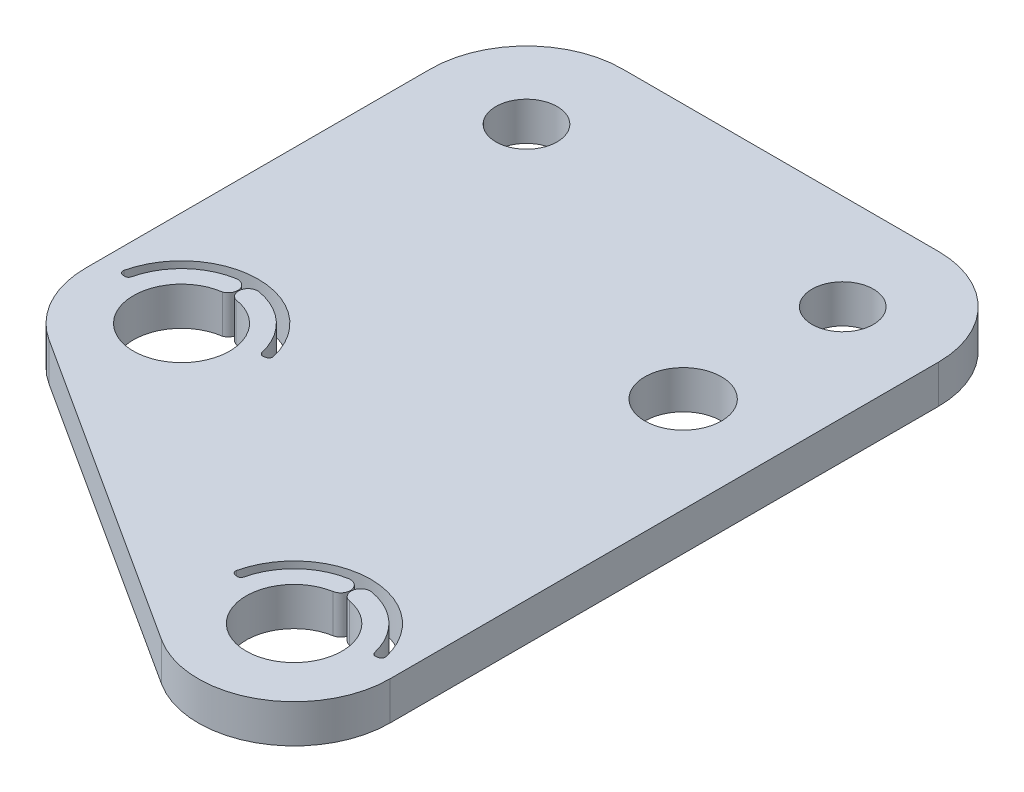
from build123d import *

# Parameters (mm, degrees)
SKETCH1_R           = 2.51
SKETCH1_R_2         = 2.5
SKETCH1_R_3         = 1.6
SKETCH1_R_4         = 2
BOSS_EXTRUDE1_DEPTH = 2
FILLET1_R           = 5
CUT_EXTRUDE2_DEPTH  = 47.884332404
SKETCH3_W           = 0.508814103
SKETCH3_H           = 0.135683761
CUT_EXTRUDE3_DEPTH  = 0.4


with BuildPart() as part:
    # Sketch1 → Boss-Extrude1 (new body)
    with BuildSketch(Plane(origin=(0, 0, 0), x_dir=(1, 0, 0), z_dir=(0, 1, 0))):
        Polygon((0, 0), (26.5, 0), (26.5, -42.791666667), (0, -25.727272727), align=None)
        with Locations((5, -23)):
            Circle(SKETCH1_R, mode=Mode.SUBTRACT)
        with Locations((21.5, -33.625)):
            Circle(SKETCH1_R_2, mode=Mode.SUBTRACT)
        with Locations((21.5, -5)):
            Circle(SKETCH1_R_3, mode=Mode.SUBTRACT)
        with Locations((5, -5)):
            Circle(SKETCH1_R_3, mode=Mode.SUBTRACT)
        with Locations((21.5, -13.325)):
            Circle(SKETCH1_R_4, mode=Mode.SUBTRACT)
    extrude(amount=BOSS_EXTRUDE1_DEPTH)

    # Fillet1
    fillet1_edges = [part.edges().sort_by_distance(p)[0] for p in [
        (26.5, 1, 0),
        (0, 1, 0),
        (0, 1, 25.727272727),
        (26.5, 1, 42.791666667),
    ]]
    fillet(fillet1_edges, radius=FILLET1_R)

    # Sketch2 → Cut-Extrude2 (cut, through all)
    with BuildSketch(Plane(origin=(0, 2, 0), x_dir=(1, 0, 0), z_dir=(0, 1, 0))):
        with BuildLine():
            Line((17.861538493, -32.983441068), (17.762917332, -32.966051496))
            ThreePointArc((17.762917332, -32.966051496), (17.630853466, -32.879452656), (17.602786281, -32.724042048))
            ThreePointArc((17.602786281, -32.724042048), (21.5, -29.625), (25.397213719, -32.724042048))
            ThreePointArc((25.397213719, -32.724042048), (25.369146534, -32.879452656), (25.237082668, -32.966051496))
            Line((25.237082668, -32.966051496), (25.138461507, -32.983441068))
            ThreePointArc((25.138461507, -32.983441068), (24.993487988, -32.953351583), (24.908935554, -32.831804949))
            ThreePointArc((24.908935554, -32.831804949), (23.907056069, -31.084118051), (22.107768622, -30.178172864))
            ThreePointArc((22.107768622, -30.178172864), (21.528540656, -30.583752652), (21.934120444, -31.162980617))
            ThreePointArc((21.934120444, -31.162980617), (21.5, -31.125), (21.065879556, -31.162980617))
            ThreePointArc((21.065879556, -31.162980617), (21.471459344, -30.583752652), (20.892231378, -30.178172864))
            ThreePointArc((20.892231378, -30.178172864), (19.092943931, -31.084118051), (18.091064446, -32.831804949))
            ThreePointArc((18.091064446, -32.831804949), (18.006512012, -32.953351583), (17.861538493, -32.983441068))
        make_face()
        with BuildLine():
            Line((1.361538493, -22.358441068), (1.262917332, -22.341051496))
            ThreePointArc((1.262917332, -22.341051496), (1.130853466, -22.254452656), (1.102786281, -22.099042048))
            ThreePointArc((1.102786281, -22.099042048), (5, -19), (8.897213719, -22.099042048))
            ThreePointArc((8.897213719, -22.099042048), (8.869146534, -22.254452656), (8.737082668, -22.341051496))
            Line((8.737082668, -22.341051496), (8.638461507, -22.358441068))
            ThreePointArc((8.638461507, -22.358441068), (8.493487988, -22.328351583), (8.408935554, -22.206804949))
            ThreePointArc((8.408935554, -22.206804949), (7.407056069, -20.459118051), (5.607768622, -19.553172864))
            ThreePointArc((5.607768622, -19.553172864), (5.028540656, -19.958752652), (5.434120444, -20.537980617))
            ThreePointArc((5.434120444, -20.537980617), (5, -20.5), (4.565879556, -20.537980617))
            ThreePointArc((4.565879556, -20.537980617), (4.971459344, -19.958752652), (4.392231378, -19.553172864))
            ThreePointArc((4.392231378, -19.553172864), (2.592943931, -20.459118051), (1.591064446, -22.206804949))
            ThreePointArc((1.591064446, -22.206804949), (1.506512012, -22.328351583), (1.361538493, -22.358441068))
        make_face()
    extrude(amount=-CUT_EXTRUDE2_DEPTH, mode=Mode.SUBTRACT)

    # Sketch3 → Cut-Extrude3 (cut)
    # profile 1 of 6: a face of its own
    with BuildSketch(Plane(origin=(0, 0, 0), x_dir=(-1, 0, 0), z_dir=(0, 0, -1))):
        Polygon((-16.413127671, 0.4), (-16.238487831, 1.722916667), (-16.22152736, 1.722916667), (-15.675347222, 0.637446581), (-15.130492121, 1.722916667), (-15.113266643, 1.722916667), (-14.937566774, 0.4), (-15.056820079, 0.4), (-15.18349359, 1.351906384), (-15.661036826, 0.4), (-15.687802567, 0.4), (-16.167200855, 1.354026442), (-16.293609358, 0.4), align=None)
    # profile 2 of 6: a face of its own
    with BuildSketch(Plane(origin=(0, 0, 0), x_dir=(-1, 0, 0), z_dir=(0, 0, -1))):
        with BuildLine():
            Line((-14.666199252, 1.722916667), (-14.401456914, 1.722916667))
            add(Edge.make_bspline(
                [(-14.401456914, 1.722916667), (-14.383789881, 1.722857859), (-14.349867219, 1.722744941), (-14.301269584, 1.722115323), (-14.257111723, 1.72031073), (-14.217416724, 1.718757783), (-14.182185316, 1.715926008), (-14.151309465, 1.713219454), (-14.124931377, 1.709676433), (-14.108963451, 1.70638599), (-14.101733607, 1.704896167)],
                knots=[0, 0, 0, 0, 1.410062039, 2.707475311, 3.878576406, 4.937260626, 5.877586885, 6.699081471, 7.410979367, 8, 8, 8, 8], degree=3))
            add(Edge.make_bspline(
                [(-14.101733607, 1.704896167), (-14.092054913, 1.702504801), (-14.072903997, 1.697773082), (-14.045330609, 1.687771982), (-14.01905585, 1.676198493), (-13.994188863, 1.662605063), (-13.970854203, 1.646890786), (-13.948811271, 1.629326943), (-13.927960039, 1.610009636), (-13.909143768, 1.588451824), (-13.891401924, 1.565835048), (-13.876438366, 1.541378568), (-13.863539369, 1.515804122), (-13.85326956, 1.488851616), (-13.845000207, 1.460782434), (-13.839169456, 1.431342323), (-13.835672727, 1.400665407), (-13.835316729, 1.379741436), (-13.835136218, 1.369131861)],
                knots=[0, 0, 0, 0, 1.027469482, 2.033020251, 3.019912614, 3.986113645, 4.951240523, 5.91722682, 6.890402269, 7.87763091, 8.8651537, 9.85103654, 10.82876324, 11.815024772, 12.821070561, 13.842952187, 14.906261191, 16, 16, 16, 16], degree=3))
            add(Edge.make_bspline(
                [(-13.835136218, 1.369131861), (-13.835691464, 1.351504902), (-13.836774894, 1.317110139), (-13.846876346, 1.26719427), (-13.863422829, 1.220631642), (-13.886223596, 1.177480883), (-13.915259528, 1.13858311), (-13.950156101, 1.10441767), (-13.990932782, 1.075827584), (-14.028892672, 1.056001672), (-14.062424527, 1.043304353), (-14.090029381, 1.034370372), (-14.120141601, 1.027467784), (-14.152472677, 1.021284043), (-14.187157154, 1.016615397), (-14.224111901, 1.013196), (-14.263363274, 1.011058904), (-14.290327744, 1.010740646), (-14.304199219, 1.010576923)],
                knots=[0, 0, 0, 0, 1.260483769, 2.459530307, 3.627416485, 4.787058657, 5.939039949, 7.08810263, 8.267026773, 9.491475466, 10.141966685, 10.831826277, 11.566392101, 12.351337768, 13.187381173, 14.07005841, 15.007169909, 16, 16, 16, 16], degree=3))
            Line((-14.304199219, 1.010576923), (-13.818175748, 0.4))
            Line((-13.818175748, 0.4), (-13.964989817, 0.4))
            Line((-13.964989817, 0.4), (-14.451013288, 1.010576923))
            Line((-14.451013288, 1.010576923), (-14.547475962, 1.010576923))
            Line((-14.547475962, 1.010576923), (-14.547475962, 0.4))
            Line((-14.547475962, 0.4), (-14.666199252, 0.4))
            Line((-14.666199252, 0.4), (-14.666199252, 1.722916667))
        make_face()
        with BuildLine():
            Line((-14.547475962, 1.587232906), (-14.547475962, 1.146260684))
            Line((-14.547475962, 1.146260684), (-14.305259248, 1.144405632))
            add(Edge.make_bspline(
                [(-14.305259248, 1.144405632), (-14.293950186, 1.144400629), (-14.272030002, 1.144390932), (-14.240317548, 1.145900484), (-14.210790006, 1.14761775), (-14.183560317, 1.150244437), (-14.158616317, 1.153629619), (-14.135970473, 1.15786408), (-14.11558582, 1.162797449), (-14.09181167, 1.170433183), (-14.065263933, 1.182530696), (-14.036412459, 1.200131346), (-14.011843123, 1.222269078), (-13.991085478, 1.24758345), (-13.974405604, 1.275416199), (-13.962645988, 1.305433695), (-13.955183815, 1.336878139), (-13.95430368, 1.358490102), (-13.953859509, 1.369396868)],
                knots=[0, 0, 0, 0, 1.146690395, 2.22261258, 3.21895312, 4.145990853, 4.996080663, 5.770904154, 6.481378293, 7.121626537, 8.300444488, 9.431385265, 10.535395872, 11.636531494, 12.74115979, 13.810798291, 14.895190096, 16, 16, 16, 16], degree=3))
            add(Edge.make_bspline(
                [(-13.953859509, 1.369396868), (-13.954313882, 1.380035603), (-13.955214283, 1.401117693), (-13.962565455, 1.431981683), (-13.974996858, 1.461111155), (-13.991749609, 1.488387612), (-14.012160004, 1.513147221), (-14.036092629, 1.53433171), (-14.062893105, 1.551812907), (-14.08794204, 1.562983759), (-14.110331162, 1.569832632), (-14.129770349, 1.574652268), (-14.151735104, 1.578524434), (-14.176332078, 1.581626885), (-14.203456265, 1.584293486), (-14.233244815, 1.586089546), (-14.265500086, 1.587153119), (-14.287856218, 1.587205691), (-14.299429087, 1.587232906)],
                knots=[0, 0, 0, 0, 1.101028733, 2.181837193, 3.264309656, 4.369019818, 5.486613113, 6.575447106, 7.666700264, 8.788928104, 9.402425223, 10.0903467, 10.862060571, 11.710948788, 12.657782767, 13.684531032, 14.801375019, 16, 16, 16, 16], degree=3))
            Line((-14.299429087, 1.587232906), (-14.547475962, 1.587232906))
        make_face(mode=Mode.SUBTRACT)
    # profile 3 of 6: a face of its own
    with BuildSketch(Plane(origin=(0, 0, 0), x_dir=(-1, 0, 0), z_dir=(0, 0, -1))):
        with BuildLine():
            Line((-13.546808226, 1.722916667), (-13.287366036, 1.722916667))
            add(Edge.make_bspline(
                [(-13.287366036, 1.722916667), (-13.269521437, 1.722897051), (-13.235330394, 1.722859467), (-13.186301191, 1.721719965), (-13.141771918, 1.720197971), (-13.101838589, 1.718088148), (-13.066378338, 1.715594794), (-13.035551621, 1.712097744), (-13.009116134, 1.708446382), (-12.993276493, 1.704734124), (-12.986052684, 1.703041116)],
                knots=[0, 0, 0, 0, 1.415646017, 2.712440637, 3.8905458, 4.950247383, 5.884950622, 6.709939814, 7.411656543, 8, 8, 8, 8], degree=3))
            add(Edge.make_bspline(
                [(-12.986052684, 1.703041116), (-12.976908105, 1.700538176), (-12.958834426, 1.695591276), (-12.932791472, 1.685683113), (-12.908013679, 1.673934795), (-12.884416036, 1.660545389), (-12.862288523, 1.644940428), (-12.841301001, 1.627752484), (-12.821638688, 1.608584718), (-12.80341215, 1.587652117), (-12.78667355, 1.565306085), (-12.772261438, 1.54121304), (-12.760193707, 1.51577853), (-12.749843482, 1.489020245), (-12.742394155, 1.460713486), (-12.736782381, 1.431054937), (-12.733220474, 1.400047777), (-12.732879327, 1.378858482), (-12.732705662, 1.368071832)],
                knots=[0, 0, 0, 0, 0.999701418, 1.975846123, 2.934577507, 3.890451536, 4.834027766, 5.787354733, 6.749476667, 7.726910423, 8.712836071, 9.690891519, 10.682875813, 11.679750201, 12.712814741, 13.765529915, 14.8625177, 16, 16, 16, 16], degree=3))
            add(Edge.make_bspline(
                [(-12.732705662, 1.368071832), (-12.732864951, 1.357194517), (-12.73317661, 1.335912317), (-12.73691717, 1.304777364), (-12.741955665, 1.275023687), (-12.749703063, 1.246717258), (-12.759850088, 1.220026178), (-12.771753334, 1.194542557), (-12.786110204, 1.170699943), (-12.802606911, 1.148411777), (-12.820958257, 1.127657137), (-12.8410866, 1.108586426), (-12.862910678, 1.091311275), (-12.886361133, 1.075792954), (-12.911666581, 1.062391325), (-12.938443229, 1.05038782), (-12.966923817, 1.040306794), (-12.986632445, 1.035003765), (-12.996652978, 1.032307525)],
                knots=[0, 0, 0, 0, 1.121902311, 2.195077645, 3.232258892, 4.234102512, 5.217864754, 6.176164875, 7.132989551, 8.084763148, 9.034132444, 9.988522005, 10.94243251, 11.903244335, 12.886203696, 13.894208494, 14.929344452, 16, 16, 16, 16], degree=3))
            add(Edge.make_bspline(
                [(-12.996652978, 1.032307525), (-13.004940988, 1.03054503), (-13.023104644, 1.026682417), (-13.053018709, 1.022370292), (-13.087847471, 1.018689711), (-13.127543392, 1.015930055), (-13.172070841, 1.013567565), (-13.221453906, 1.011689743), (-13.275789524, 1.010657924), (-13.313689667, 1.010604707), (-13.333477314, 1.010576923)],
                knots=[0, 0, 0, 0, 0.601384939, 1.31797006, 2.144135048, 3.087295005, 4.142315834, 5.309527816, 6.595305764, 8, 8, 8, 8], degree=3))
            Line((-13.333477314, 1.010576923), (-13.428084936, 1.010576923))
            Line((-13.428084936, 1.010576923), (-13.428084936, 0.4))
            Line((-13.428084936, 0.4), (-13.546808226, 0.4))
            Line((-13.546808226, 0.4), (-13.546808226, 1.722916667))
        make_face()
        with BuildLine():
            Line((-13.428084936, 1.587232906), (-13.428084936, 1.146260684))
            Line((-13.428084936, 1.146260684), (-13.196468516, 1.143345603))
            add(Edge.make_bspline(
                [(-13.196468516, 1.143345603), (-13.185159497, 1.143339758), (-13.163327668, 1.143328475), (-13.131790762, 1.144834794), (-13.102531894, 1.146573686), (-13.075640939, 1.149119705), (-13.051105773, 1.152718513), (-13.028885487, 1.156351521), (-13.009152377, 1.161607417), (-12.986058333, 1.168684292), (-12.960324449, 1.18075406), (-12.932328679, 1.198273215), (-12.908602892, 1.220604316), (-12.888071869, 1.245712455), (-12.871778874, 1.273644566), (-12.85985146, 1.303530742), (-12.852843344, 1.335064482), (-12.851903622, 1.35664244), (-12.851428953, 1.367541817)],
                knots=[0, 0, 0, 0, 1.160613943, 2.240541288, 3.23993089, 4.169200891, 5.011653406, 5.7853311, 6.478053781, 7.106038997, 8.262395093, 9.384106736, 10.481365981, 11.59014053, 12.70357646, 13.786202915, 14.881775077, 16, 16, 16, 16], degree=3))
            add(Edge.make_bspline(
                [(-12.851428953, 1.367541817), (-12.851906203, 1.378177505), (-12.852854918, 1.399319937), (-12.85990639, 1.430305956), (-12.871755684, 1.45987719), (-12.888181242, 1.487459279), (-12.908116134, 1.512477071), (-12.931285826, 1.534209616), (-12.957635779, 1.551680319), (-12.982146866, 1.562956589), (-13.003918743, 1.569841529), (-13.022829633, 1.574658776), (-13.044181762, 1.578504912), (-13.067982084, 1.581619248), (-13.094046125, 1.584285289), (-13.12259781, 1.586094274), (-13.153528978, 1.587153158), (-13.175002022, 1.58720568), (-13.18613323, 1.587232906)],
                knots=[0, 0, 0, 0, 1.120700087, 2.227813068, 3.331159281, 4.466773991, 5.599788987, 6.693661531, 7.80175334, 8.91857717, 9.525282508, 10.207424825, 10.974604443, 11.810962634, 12.737642355, 13.736264703, 14.826523623, 16, 16, 16, 16], degree=3))
            Line((-13.18613323, 1.587232906), (-13.428084936, 1.587232906))
        make_face(mode=Mode.SUBTRACT)
    # profile 4 of 6: a face of its own
    with BuildSketch(Plane(origin=(0, 0, 0), x_dir=(-1, 0, 0), z_dir=(0, 0, -1))):
        with Locations((-12.325654381, 0.908814103)):
            Rectangle(SKETCH3_W, SKETCH3_H)
    # profile 5 of 6: a face of its own
    with BuildSketch(Plane(origin=(0, 0, 0), x_dir=(-1, 0, 0), z_dir=(0, 0, -1))):
        with BuildLine():
            add(Edge.make_bspline(
                [(-11.969484509, 1.060928319), (-11.969360525, 1.082131796), (-11.969119687, 1.123319855), (-11.966440432, 1.183336669), (-11.961989633, 1.239640112), (-11.955890091, 1.292232878), (-11.948467402, 1.341128545), (-11.938558572, 1.386196444), (-11.927290042, 1.427645164), (-11.91423004, 1.465609867), (-11.899493584, 1.500602035), (-11.883454444, 1.533268703), (-11.865476084, 1.563560445), (-11.846586001, 1.591960741), (-11.826019534, 1.618004697), (-11.804361955, 1.642060108), (-11.780767972, 1.663571017), (-11.756039633, 1.683167685), (-11.729953052, 1.700346503), (-11.703251807, 1.715477925), (-11.675752109, 1.728404661), (-11.647378879, 1.738568605), (-11.618387138, 1.746963776), (-11.588675539, 1.752704837), (-11.558195023, 1.756317121), (-11.537621237, 1.756662465), (-11.52718725, 1.756837607)],
                knots=[0, 0, 0, 0, 1.646270934, 3.197905019, 4.663502075, 6.030701355, 7.308322542, 8.50163776, 9.611534131, 10.641858119, 11.616356847, 12.558055219, 13.465016945, 14.349605745, 15.204443733, 16.039544428, 16.859896111, 17.680448484, 18.487036065, 19.28249412, 20.06191084, 20.843045899, 21.620316918, 22.403196591, 23.190181807, 24, 24, 24, 24], degree=3))
            add(Edge.make_bspline(
                [(-11.52718725, 1.756837607), (-11.516666101, 1.756653224), (-11.495742848, 1.756286545), (-11.464809135, 1.752762317), (-11.434590059, 1.746914601), (-11.405214453, 1.738628995), (-11.37644102, 1.728349676), (-11.348494819, 1.715465558), (-11.321202261, 1.700467891), (-11.294997063, 1.682845175), (-11.269591539, 1.663197112), (-11.245609719, 1.640986223), (-11.223049422, 1.616436775), (-11.201627506, 1.589811428), (-11.18195173, 1.560599506), (-11.163214153, 1.529309083), (-11.14644258, 1.495392953), (-11.13028989, 1.459417002), (-11.116347487, 1.420385798), (-11.103773638, 1.378519356), (-11.093614028, 1.33332316), (-11.085151416, 1.285034341), (-11.078595459, 1.23347556), (-11.073820621, 1.17875734), (-11.071298354, 1.12084368), (-11.07082335, 1.081247708), (-11.070579594, 1.060928319)],
                knots=[0, 0, 0, 0, 0.810914788, 1.612654377, 2.396697861, 3.181598691, 3.963628158, 4.749916497, 5.551656086, 6.361998678, 7.18212741, 8.025565596, 8.878627764, 9.750805457, 10.657531673, 11.591944965, 12.560506719, 13.57287815, 14.630710178, 15.753379473, 16.941251878, 18.199788006, 19.531962791, 20.947069417, 22.433333509, 24, 24, 24, 24], degree=3))
            add(Edge.make_bspline(
                [(-11.070579594, 1.060928319), (-11.070825877, 1.040697556), (-11.071305751, 1.001278739), (-11.073792345, 0.943625663), (-11.078690399, 0.889197831), (-11.084817389, 0.837864709), (-11.093303318, 0.789839955), (-11.103737414, 0.74495738), (-11.115322506, 0.703023163), (-11.129623158, 0.664380838), (-11.14527542, 0.628491348), (-11.162305211, 0.594977277), (-11.180550056, 0.563542398), (-11.20042735, 0.534438327), (-11.221614206, 0.507458894), (-11.244564084, 0.483080329), (-11.268630049, 0.460715224), (-11.294110337, 0.440814162), (-11.320724227, 0.423395203), (-11.347923045, 0.407817349), (-11.376189383, 0.395256181), (-11.404882672, 0.384470615), (-11.434413334, 0.376230564), (-11.464744559, 0.370533005), (-11.495722065, 0.366537098), (-11.516662538, 0.366232268), (-11.52718725, 0.36607906)],
                knots=[0, 0, 0, 0, 1.561518951, 3.042555995, 4.452378317, 5.7783523, 7.031515105, 8.214008947, 9.334062868, 10.386615937, 11.391082383, 12.354592575, 13.286541444, 14.194233754, 15.072674879, 15.931287219, 16.775624067, 17.606195743, 18.42308326, 19.229000347, 20.022332153, 20.807536673, 21.593273796, 22.3848459, 23.188221202, 24, 24, 24, 24], degree=3))
            add(Edge.make_bspline(
                [(-11.52718725, 0.36607906), (-11.537620947, 0.366255331), (-11.558194163, 0.366602904), (-11.58867886, 0.370198868), (-11.618267759, 0.375980204), (-11.647106872, 0.38407517), (-11.675344156, 0.393983754), (-11.702594835, 0.406893033), (-11.729161906, 0.421760375), (-11.754974489, 0.438691978), (-11.779547538, 0.458090352), (-11.803019332, 0.479545901), (-11.824800217, 0.503594036), (-11.845072628, 0.529855037), (-11.86433962, 0.558087304), (-11.882062687, 0.588676302), (-11.898455837, 0.621500741), (-11.913440132, 0.65677269), (-11.92672549, 0.695006844), (-11.938460785, 0.736640611), (-11.947726553, 0.782041461), (-11.95565761, 0.830844752), (-11.962054624, 0.883260196), (-11.966421884, 0.939316249), (-11.969121131, 0.99897798), (-11.969361172, 1.039901376), (-11.969484509, 1.060928319)],
                knots=[0, 0, 0, 0, 0.810891512, 1.598919785, 2.382837074, 3.152667961, 3.926044502, 4.706494248, 5.493654104, 6.291793342, 7.103789334, 7.925228297, 8.761435821, 9.622817696, 10.50288917, 11.416980706, 12.369136599, 13.353924996, 14.394355917, 15.514179734, 16.714354668, 17.994756427, 19.357759367, 20.818452758, 22.365282078, 24, 24, 24, 24], degree=3))
        make_face()
        with BuildLine():
            add(Edge.make_bspline(
                [(-11.850761218, 1.061458333), (-11.85071607, 1.043788438), (-11.850628446, 1.009494642), (-11.848339346, 0.959661028), (-11.845220955, 0.913181172), (-11.841198798, 0.869996055), (-11.83522566, 0.830251854), (-11.828532916, 0.793675218), (-11.820388251, 0.760459715), (-11.810751741, 0.730377417), (-11.799775654, 0.702917799), (-11.787791592, 0.677366149), (-11.77491745, 0.653420626), (-11.760509319, 0.631296315), (-11.744817613, 0.610921069), (-11.728196768, 0.591934254), (-11.710026476, 0.575002062), (-11.684889645, 0.55469459), (-11.651704668, 0.533709679), (-11.60989277, 0.515436008), (-11.566928802, 0.503952163), (-11.537767466, 0.502491755), (-11.523212139, 0.501762821)],
                knots=[0, 0, 0, 0, 1.459021318, 2.831673884, 4.118529203, 5.306027144, 6.411944654, 7.436330062, 8.375795394, 9.233974572, 10.042671642, 10.816086306, 11.563610507, 12.285937304, 12.993564865, 13.685989202, 14.367179055, 15.041617293, 16.353048772, 17.594441528, 18.799311195, 20, 20, 20, 20], degree=3))
            add(Edge.make_bspline(
                [(-11.523212139, 0.501762821), (-11.508562662, 0.502366744), (-11.479293954, 0.503573343), (-11.436532073, 0.515214532), (-11.395018846, 0.532778912), (-11.362485702, 0.553547761), (-11.337734859, 0.573326623), (-11.320001354, 0.590189898), (-11.303724925, 0.609072026), (-11.288287593, 0.629444677), (-11.274128955, 0.651697074), (-11.2612539, 0.675722214), (-11.249505134, 0.701586814), (-11.242811537, 0.719642638), (-11.239389273, 0.728874115)],
                knots=[0, 0, 0, 0, 1.353760809, 2.704726607, 4.075137775, 5.516104923, 6.260822281, 7.007110065, 7.778089737, 8.566572457, 9.372053459, 10.217411131, 11.088608312, 12, 12, 12, 12], degree=3))
            add(Edge.make_bspline(
                [(-11.239389273, 0.728874115), (-11.235400956, 0.740678213), (-11.227302962, 0.764645594), (-11.216866369, 0.801824713), (-11.208647126, 0.8408329), (-11.201252639, 0.881437037), (-11.196205502, 0.923936567), (-11.192143084, 0.968199991), (-11.189750235, 1.014260685), (-11.189453618, 1.04555522), (-11.189302885, 1.061458333)],
                knots=[0, 0, 0, 0, 0.884706709, 1.796334032, 2.740027952, 3.714592787, 4.726048262, 5.777819803, 6.87074269, 8, 8, 8, 8], degree=3))
            add(Edge.make_bspline(
                [(-11.189302885, 1.061458333), (-11.189510843, 1.077358874), (-11.189917654, 1.108463731), (-11.191472644, 1.154016734), (-11.195488102, 1.197282822), (-11.199947888, 1.238448388), (-11.206523623, 1.277285556), (-11.213613628, 1.314119451), (-11.223139086, 1.348493749), (-11.23331412, 1.380946626), (-11.244959716, 1.411109374), (-11.257779056, 1.43912262), (-11.271470018, 1.465121609), (-11.286340448, 1.489035006), (-11.302213817, 1.510969926), (-11.319509081, 1.530486573), (-11.337540198, 1.548189832), (-11.362795503, 1.56839741), (-11.395858702, 1.589001533), (-11.436999765, 1.607962996), (-11.479813372, 1.618851845), (-11.508756314, 1.620387066), (-11.523212139, 1.621153846)],
                knots=[0, 0, 0, 0, 1.31362396, 2.569729283, 3.763502607, 4.902122613, 5.988968491, 7.01645872, 7.998833611, 8.933434873, 9.825090667, 10.667526885, 11.477055099, 12.250526234, 12.991942729, 13.710640831, 14.402115721, 15.076753259, 16.378508321, 17.609869233, 18.806226677, 20, 20, 20, 20], degree=3))
            add(Edge.make_bspline(
                [(-11.523212139, 1.621153846), (-11.537843822, 1.620386008), (-11.567133841, 1.618848932), (-11.610392443, 1.608003565), (-11.651858076, 1.589099855), (-11.684833843, 1.568329167), (-11.710106763, 1.548546531), (-11.7279029, 1.531391532), (-11.744589102, 1.51262643), (-11.759960524, 1.492063801), (-11.774357366, 1.469965284), (-11.787579356, 1.446157031), (-11.799492156, 1.420518391), (-11.810485418, 1.393071107), (-11.820151323, 1.362991405), (-11.828124339, 1.329816815), (-11.835489981, 1.293356516), (-11.840704265, 1.25339706), (-11.845339672, 1.210201127), (-11.848318634, 1.163605235), (-11.850636104, 1.113688044), (-11.850718678, 1.079216934), (-11.850761218, 1.061458333)],
                knots=[0, 0, 0, 0, 1.207732386, 2.417664972, 3.655092373, 4.956220595, 5.625982001, 6.301752483, 6.994047911, 7.697131622, 8.419323945, 9.170223765, 9.943494443, 10.752040957, 11.610060368, 12.549350801, 13.567764191, 14.679664412, 15.874934091, 17.154273443, 18.533957287, 20, 20, 20, 20], degree=3))
        make_face(mode=Mode.SUBTRACT)
    # profile 6 of 6: a face of its own
    with BuildSketch(Plane(origin=(0, 0, 0), x_dir=(-1, 0, 0), z_dir=(0, 0, -1))):
        Polygon((-10.67068351, 1.722916667), (-10.426081731, 1.722916667), (-10.426081731, 0.4), (-10.544805021, 0.4), (-10.544805021, 1.587232906), (-10.748330662, 1.587232906), align=None)
    extrude(amount=-CUT_EXTRUDE3_DEPTH, mode=Mode.SUBTRACT)


solid = part.part
